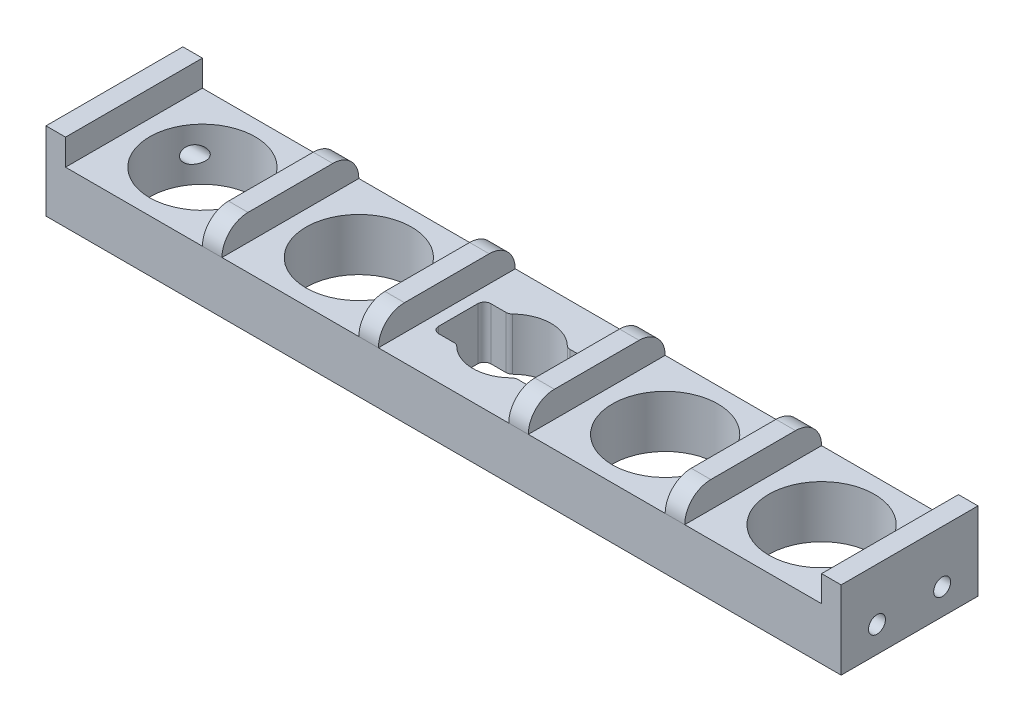
from build123d import *

# Parameters (mm, degrees)
SKETCH1_W           = 122
SKETCH1_H           = 21
SKETCH1_R           = 8.1
BOSS_EXTRUDE1_DEPTH = 8
CUT_EXTRUDE1_DEPTH  = 122
FILLET2_R           = 1
SKETCH6_W           = 3
SKETCH6_H           = 21
BOSS_EXTRUDE4_DEPTH = 4
FILLET3_R           = 4
SKETCH7_R           = 1.3
CUT_EXTRUDE2_DEPTH  = 10


with BuildPart() as part:
    # Sketch1 → Boss-Extrude1 (new body)
    with BuildSketch(Plane(origin=(0, 0, 0), x_dir=(1, 0, 0), z_dir=(0, 1, 0))):
        Rectangle(SKETCH1_W, SKETCH1_H)
        with Locations((-47.5, 0)):
            Circle(SKETCH1_R, mode=Mode.SUBTRACT)
        with Locations((-23.5, 0)):
            Circle(SKETCH1_R, mode=Mode.SUBTRACT)
        with Locations((23.5, 0)):
            Circle(SKETCH1_R, mode=Mode.SUBTRACT)
        with Locations((47.5, 0)):
            Circle(SKETCH1_R, mode=Mode.SUBTRACT)
    extrude(amount=BOSS_EXTRUDE1_DEPTH)

    # Sketch4 → Cut-Extrude1 (cut)
    with BuildSketch(Plane(origin=(0, 8, 0), x_dir=(1, 0, 0), z_dir=(0, 1, 0))):
        with BuildLine():
            Line((-4.472135955, 4), (-8.25, 4))
            Line((-8.25, 4), (-8.25, -4))
            Line((-8.25, -4), (-4.472135955, -4))
            ThreePointArc((-4.472135955, -4), (0, -6), (4.472135955, -4))
            Line((4.472135955, -4), (8.25, -4))
            Line((8.25, -4), (8.25, 4))
            Line((8.25, 4), (4.472135955, 4))
            ThreePointArc((4.472135955, 4), (0, 6), (-4.472135955, 4))
        make_face()
    extrude(amount=-CUT_EXTRUDE1_DEPTH, mode=Mode.SUBTRACT)

    # Fillet2
    fillet2_edges = [part.edges().sort_by_distance(p)[0] for p in [
        (-8.25, 4, 4),
        (-4.472135955, 4, 4),
        (4.472135955, 4, 4),
        (8.25, 4, 4),
        (8.25, 4, -4),
        (4.472135955, 4, -4),
        (-4.472135955, 4, -4),
        (-8.25, 4, -4),
    ]]
    fillet(fillet2_edges, radius=FILLET2_R)

    # Sketch6 → Boss-Extrude4 (add)
    with BuildSketch(Plane(origin=(0, 8, 0), x_dir=(1, 0, 0), z_dir=(0, 1, 0))):
        with Locations((-59.5, 0)):
            Rectangle(SKETCH6_W, SKETCH6_H)
        with Locations((-35.5, 0)):
            Rectangle(SKETCH6_W, SKETCH6_H)
        with Locations((35.5, 0)):
            Rectangle(SKETCH6_W, SKETCH6_H)
        with Locations((59.5, 0)):
            Rectangle(SKETCH6_W, SKETCH6_H)
        with Locations((-11.5, 0)):
            Rectangle(SKETCH6_W, SKETCH6_H)
        with Locations((11.5, 0)):
            Rectangle(SKETCH6_W, SKETCH6_H)
    extrude(amount=BOSS_EXTRUDE4_DEPTH)

    # Fillet3
    fillet3_edges = [part.edges().sort_by_distance(p)[0] for p in [
        (35.5, 12, 10.5),
        (11.5, 12, 10.5),
        (-11.5, 12, 10.5),
        (-35.5, 12, 10.5),
        (35.5, 12, -10.5),
        (11.5, 12, -10.5),
        (-11.5, 12, -10.5),
        (-35.5, 12, -10.5),
    ]]
    fillet(fillet3_edges, radius=FILLET3_R)

    # Sketch7 → Cut-Extrude2 (cut)
    with BuildSketch(Plane(origin=(61, 0, 0), x_dir=(0, 0, -1), z_dir=(1, 0, 0))):
        with Locations((-5, 4)):
            Circle(SKETCH7_R)
        with Locations((5, 4)):
            Circle(SKETCH7_R)
    cut_extrude2 = extrude(amount=-CUT_EXTRUDE2_DEPTH, mode=Mode.SUBTRACT)

    # Mirror1: Cut-Extrude2 across plane
    add(cut_extrude2.mirror(Plane(origin=(0, 0, 0), x_dir=(0, 0, 1), z_dir=(1, 0, 0))), mode=Mode.SUBTRACT)


solid = part.part
